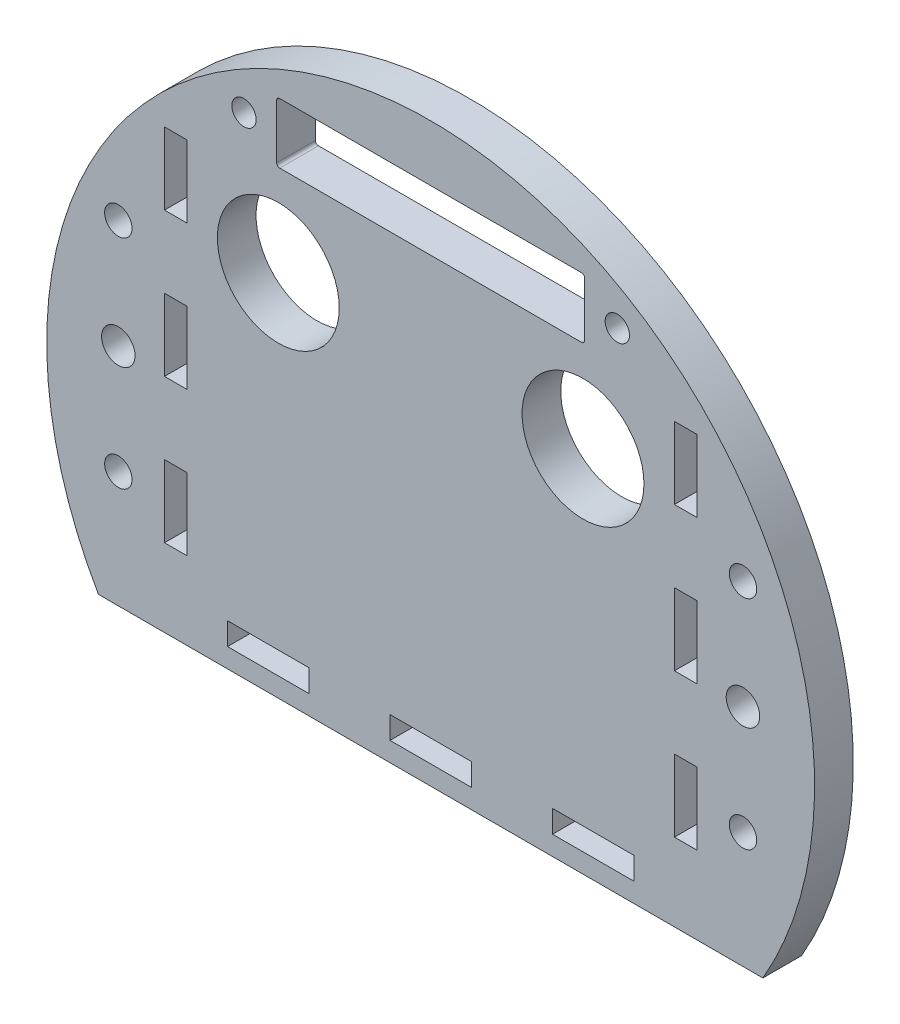
from build123d import *

# Parameters (mm, degrees)
SKETCH1_R           = 2.25
SKETCH1_R_2         = 2.75
SKETCH1_R_3         = 2
SKETCH1_R_4         = 10
SKETCH1_W           = 13.333333333
SKETCH1_H           = 3.675
SKETCH1_W_2         = 3.675
SKETCH1_H_2         = 11.818181818
SKETCH1_W_3         = 13.333333334
BOSS_EXTRUDE1_DEPTH = 6.35


with BuildPart() as part:
    # Sketch1 → Boss-Extrude1 (new body)
    with BuildSketch(Plane.XY):
        with BuildLine():
            Line((-54.514802885, -31.577464534), (54.514802885, -31.577464534))
            ThreePointArc((54.514802885, -31.577464534), (0, 63), (-54.514802885, -31.577464534))
        make_face()
        with Locations((51.25, 23.184046239)):
            Circle(SKETCH1_R, mode=Mode.SUBTRACT)
        with Locations((51.25, -12.496398734)):
            Circle(SKETCH1_R, mode=Mode.SUBTRACT)
        with Locations((-51.25, -12.496398734)):
            Circle(SKETCH1_R, mode=Mode.SUBTRACT)
        with Locations((-51.25, 23.184046239)):
            Circle(SKETCH1_R, mode=Mode.SUBTRACT)
        with Locations((-51.25, 5.343823752)):
            Circle(SKETCH1_R_2, mode=Mode.SUBTRACT)
        with Locations((51.25, 5.343823752)):
            Circle(SKETCH1_R_2, mode=Mode.SUBTRACT)
        with Locations((-30.629163068, 48.823601552)):
            Circle(SKETCH1_R_3, mode=Mode.SUBTRACT)
        with Locations((30.629163068, 48.823601552)):
            Circle(SKETCH1_R_3, mode=Mode.SUBTRACT)
        with Locations((-25, 28.878601552)):
            Circle(SKETCH1_R_4, mode=Mode.SUBTRACT)
        with Locations((25, 28.878601552)):
            Circle(SKETCH1_R_4, mode=Mode.SUBTRACT)
        with BuildLine():
            Line((-24.765, 53.768601552), (24.765, 53.768601552))
            ThreePointArc((24.765, 53.768601552), (25.118553391, 53.622154943), (25.265, 53.268601552))
            Line((25.265, 53.268601552), (25.265, 44.378601552))
            ThreePointArc((25.265, 44.378601552), (25.118553391, 44.025048162), (24.765, 43.878601552))
            Line((24.765, 43.878601552), (-24.765, 43.878601552))
            ThreePointArc((-24.765, 43.878601552), (-25.118553391, 44.025048162), (-25.265, 44.378601552))
            Line((-25.265, 44.378601552), (-25.265, 53.268601552))
            ThreePointArc((-25.265, 53.268601552), (-25.118553391, 53.622154943), (-24.765, 53.768601552))
        make_face(mode=Mode.SUBTRACT)
        with Locations((-26.666666666, -26.564964534)):
            Rectangle(SKETCH1_W, SKETCH1_H, mode=Mode.SUBTRACT)
        with Locations((41.8375, 34.363444557)):
            Rectangle(SKETCH1_W_2, SKETCH1_H_2, mode=Mode.SUBTRACT)
        with Locations((41.8375, 10.727080921)):
            Rectangle(SKETCH1_W_2, SKETCH1_H_2, mode=Mode.SUBTRACT)
        with Locations((-41.8375, 34.363444557)):
            Rectangle(SKETCH1_W_2, SKETCH1_H_2, mode=Mode.SUBTRACT)
        with Locations((-41.8375, 10.727080921)):
            Rectangle(SKETCH1_W_2, SKETCH1_H_2, mode=Mode.SUBTRACT)
        with Locations((-41.8375, -12.909282716)):
            Rectangle(SKETCH1_W_2, SKETCH1_H_2, mode=Mode.SUBTRACT)
        with Locations((41.8375, -12.909282716)):
            Rectangle(SKETCH1_W_2, SKETCH1_H_2, mode=Mode.SUBTRACT)
        with Locations((0, -26.564964534)):
            Rectangle(SKETCH1_W_3, SKETCH1_H, mode=Mode.SUBTRACT)
        with Locations((26.666666666, -26.564964534)):
            Rectangle(SKETCH1_W, SKETCH1_H, mode=Mode.SUBTRACT)
    extrude(amount=BOSS_EXTRUDE1_DEPTH)


solid = part.part
